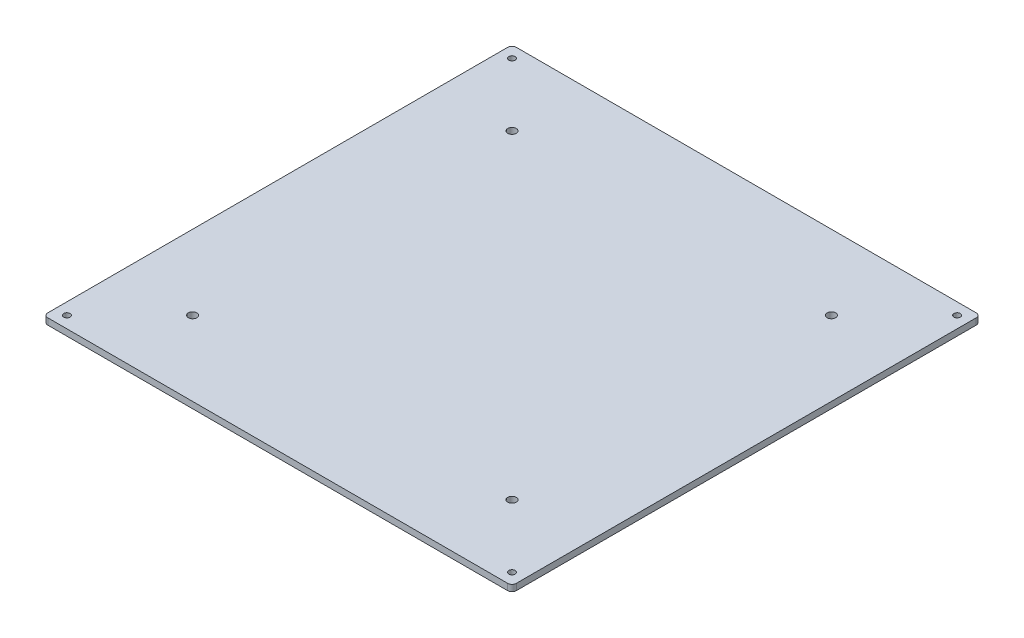
from build123d import *

# Parameters (mm, degrees)
SKETCH1_W           = 220
SKETCH1_H           = 220
BOSS_EXTRUDE1_DEPTH = 3
SKETCH3_R           = 2
SKETCH3_R_2         = 1.5
CUT_EXTRUDE1_DEPTH  = 10
FILLET1_R           = 2


with BuildPart() as part:
    # Sketch1 → Boss-Extrude1 (new body)
    with BuildSketch(Plane(origin=(0, 0, 0), x_dir=(1, 0, 0), z_dir=(0, 1, 0))):
        Rectangle(SKETCH1_W, SKETCH1_H)
    extrude(amount=BOSS_EXTRUDE1_DEPTH)

    # Sketch3 → Cut-Extrude1 (cut)
    with BuildSketch(Plane(origin=(0, 3, 0), x_dir=(1, 0, 0), z_dir=(0, 1, 0))):
        with Locations((-75, 75)):
            Circle(SKETCH3_R)
        with Locations((75, 75)):
            Circle(SKETCH3_R)
        with Locations((75, -75)):
            Circle(SKETCH3_R)
        with Locations((-75, -75)):
            Circle(SKETCH3_R)
        with Locations((-104.5, 104.5)):
            Circle(SKETCH3_R_2)
        with Locations((104.5, 104.5)):
            Circle(SKETCH3_R_2)
        with Locations((104.5, -104.5)):
            Circle(SKETCH3_R_2)
        with Locations((-104.5, -104.5)):
            Circle(SKETCH3_R_2)
    extrude(amount=-CUT_EXTRUDE1_DEPTH, mode=Mode.SUBTRACT)

    # Fillet1
    fillet1_edges = [part.edges().sort_by_distance(p)[0] for p in [
        (-110, 1.5, -110),
        (110, 1.5, -110),
        (110, 1.5, 110),
        (-110, 1.5, 110),
    ]]
    fillet(fillet1_edges, radius=FILLET1_R)


solid = part.part
